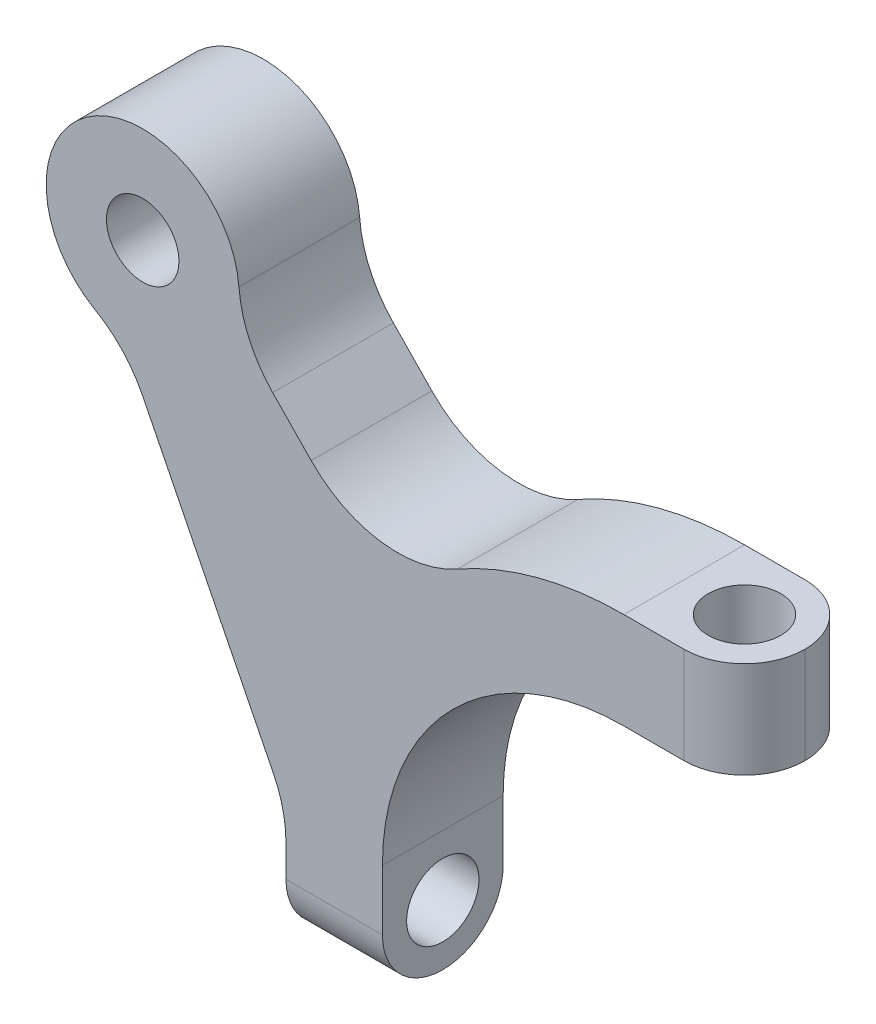
from build123d import *

# Parameters (mm, degrees)
EXTRUDE_1_DEPTH     = 2.5
FILLET_1_R          = 2.5
SKETCH_4_R          = 1.501202813
CUT_EXTRUDE_2_DEPTH = 5
SKETCH_5_R          = 1.499820195
CUT_EXTRUDE_3_DEPTH = 5
EXTRUDE_START       = -5
SKETCH_6_R          = 1.500762706
EXTRUDE_2_DEPTH     = 5
FILLET_2_R          = 5


with BuildPart() as part:
    # 草图1 → 凸台-拉伸1 (new, symmetric)
    with BuildSketch(Plane.XY):
        with BuildLine():
            Line((0, 9.998744027), (4.99606171, 9.998744027))
            Line((4.99606171, 9.998744027), (4.99606171, 13.997916296))
            Line((4.99606171, 13.997916296), (0, 13.997916296))
            ThreePointArc((0, 13.997916296), (-9.898021536, 9.898021536), (-13.997916296, 0))
            Line((-13.997916296, 0), (-13.997916296, -4.997048222))
            Line((-13.997916296, -4.997048222), (-10.001933758, -4.997048222))
            Line((-10.001933758, -4.997048222), (-10.001933758, 0))
            ThreePointArc((-10.001933758, 0), (-7.072241637, 7.071307535), (0, 9.998744027))
        make_face()
    extrude(amount=EXTRUDE_1_DEPTH, both=True)

    # 圆角1
    fillet_1_edges = [part.edges().sort_by_distance(p)[0] for p in [
        (-11.999925027, -4.997048222, -2.5),
        (-11.999925027, -4.997048222, 2.5),
        (4.99606171, 11.998330162, -2.5),
        (4.99606171, 11.998330162, 2.5),
    ]]
    fillet(fillet_1_edges, radius=FILLET_1_R - 0.0001)  # a hair under: the kernel refuses the full size

    # 草图4 → 切除-拉伸2 (cut)
    with BuildSketch(Plane(origin=(0, 13.997916296, 0), x_dir=(1, 0, 0), z_dir=(0, 1, 0))):
        with Locations(Location((2.49606171, 0, 0), (0, 0, 180))):
            Circle(SKETCH_4_R)
    extrude(amount=-CUT_EXTRUDE_2_DEPTH, mode=Mode.SUBTRACT)

    # 草图5 → 切除-拉伸3 (cut)
    with BuildSketch(Plane.ZY.offset(13.997916296)):
        with Locations((0, -2.497048222)):
            Circle(SKETCH_5_R)
    extrude(amount=-CUT_EXTRUDE_3_DEPTH, mode=Mode.SUBTRACT)

    # 草图6 → 凸台-拉伸2 (add)
    with BuildSketch(Plane(origin=(0, 0, -2.5), x_dir=(-1, 0, 0), z_dir=(0, 0, -1)).offset(EXTRUDE_START)):
        with BuildLine():
            Line((9.898430706, 9.897612349), (16.10800673, 16.291078939))
            ThreePointArc((16.10800673, 16.291078939), (21.958821842, 20.907611506), (20.772449798, 13.549831148))
            Line((20.772449798, 13.549831148), (13.997916296, 0))
            ThreePointArc((13.997916296, 0), (12.932499084, 5.356503344), (9.898430706, 9.897612349))
        make_face()
        with Locations((19.932570399, 17.459789485)):
            Circle(SKETCH_6_R, mode=Mode.SUBTRACT)
    extrude(amount=EXTRUDE_2_DEPTH)

    # 圆角2
    fillet_2_edges = [part.edges().sort_by_distance(p)[0] for p in [
        (-13.997916296, 0, 0),
        (-9.898430706, 9.897612349, 0),
        (-16.10800673, 16.291078939, 0),
        (-20.772449798, 13.549831148, 0),
    ]]
    fillet(fillet_2_edges, radius=FILLET_2_R)


solid = part.part
